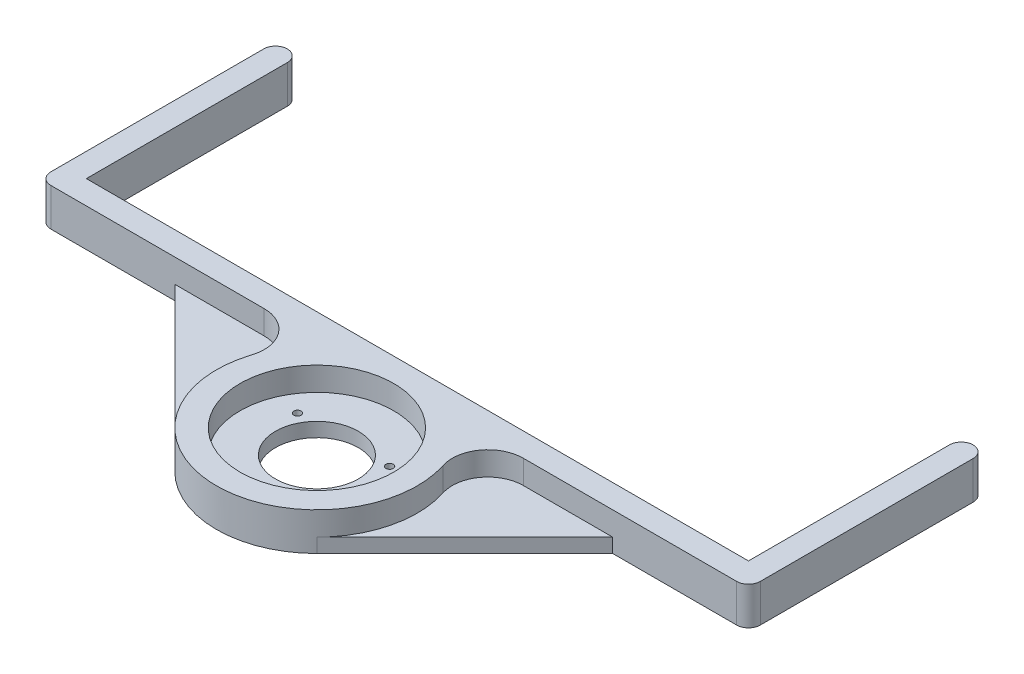
from build123d import *

# Parameters (mm, degrees)
SKETCH1_R           = 32.5
BOSS_EXTRUDE1_DEPTH = 10
FILLET1_R           = 5
FILLET2_R           = 15
BOSS_EXTRUDE2_START = 6
SKETCH2_R           = 1.55
SKETCH2_R_2         = 17.5
BOSS_EXTRUDE2_DEPTH = 6
CUT_EXTRUDE1_DEPTH  = 3


with BuildPart() as part:
    # Sketch1 → Boss-Extrude1 (new body)
    with BuildSketch(Plane(origin=(0, 0, 0), x_dir=(1, 0, 0), z_dir=(0, 1, 0))):
        with BuildLine():
            Line((0, 42.5), (140, 42.5))
            Line((140, 42.5), (140, 132.5))
            Line((140, 132.5), (150, 132.5))
            Line((150, 132.5), (150, 42.5))
            Line((150, 42.5), (150, 32.5))
            Line((150, 32.5), (27.386127875, 32.5))
            ThreePointArc((27.386127875, 32.5), (0, -42.5), (-27.386127875, 32.5))
            Line((-27.386127875, 32.5), (-150, 32.5))
            Line((-150, 32.5), (-150, 42.5))
            Line((-150, 42.5), (-150, 132.5))
            Line((-150, 132.5), (-140, 132.5))
            Line((-140, 132.5), (-140, 42.5))
            Line((-140, 42.5), (0, 42.5))
        make_face()
        with Locations(Location((0, 0, 0), (0, 0, 270))):
            Circle(SKETCH1_R, mode=Mode.SUBTRACT)
    extrude(amount=BOSS_EXTRUDE1_DEPTH)

    # Fillet1
    fillet1_edges = [part.edges().sort_by_distance(p)[0] for p in [
        (150, 5, -132.5),
        (140, 5, -132.5),
        (150, 5, -32.5),
        (-150, 5, -32.5),
        (-140, 5, -132.5),
        (-150, 5, -132.5),
    ]]
    fillet(fillet1_edges, radius=FILLET1_R - 0.0001)  # a hair under: the kernel refuses the full size

    # Fillet2
    fillet2_edges = [part.edges().sort_by_distance(p)[0] for p in [
        (27.386127875, 5, -32.5),
        (-27.386127875, 5, -32.5),
    ]]
    fillet(fillet2_edges, radius=FILLET2_R)

    # Sketch2 → Boss-Extrude2 (add)
    with BuildSketch(Plane.XZ.offset(BOSS_EXTRUDE2_START)):
        with BuildLine():
            Line((-30.0520382, 30.0520382), (-92.604076401, -32.5))
            Line((-92.604076401, -32.5), (-145, -32.5))
            ThreePointArc((-145, -32.5), (-148.535533906, -33.964466094), (-150, -37.5))
            Line((-150, -37.5), (-150, -127.5))
            ThreePointArc((-150, -127.5), (-148.535533906, -131.035533906), (-145, -132.5))
            ThreePointArc((-145, -132.5), (-141.464466094, -131.035533906), (-140, -127.5))
            Line((-140, -127.5), (-140, -42.5))
            Line((-140, -42.5), (140, -42.5))
            Line((140, -42.5), (140, -127.5))
            ThreePointArc((140, -127.5), (141.464466094, -131.035533906), (145, -132.5))
            ThreePointArc((145, -132.5), (148.535533906, -131.035533906), (150, -127.5))
            Line((150, -127.5), (150, -37.5))
            ThreePointArc((150, -37.5), (148.535533906, -33.964466094), (145, -32.5))
            Line((145, -32.5), (92.604076401, -32.5))
            Line((92.604076401, -32.5), (30.0520382, 30.0520382))
            ThreePointArc((30.0520382, 30.0520382), (0, 42.5), (-30.0520382, 30.0520382))
        make_face()
        with Locations(Location((0, 22.5, 0), (0, 0, 270))):
            Circle(SKETCH2_R, mode=Mode.SUBTRACT)
        with Locations(Location((19.485571585, -11.25, 0), (0, 0, 270))):
            Circle(SKETCH2_R, mode=Mode.SUBTRACT)
        with Locations(Location((-19.485571585, -11.25, 0), (0, 0, 270))):
            Circle(SKETCH2_R, mode=Mode.SUBTRACT)
        with Locations(Location((0, 0, 0), (0, 0, 270))):
            Circle(SKETCH2_R_2, mode=Mode.SUBTRACT)
    extrude(amount=-BOSS_EXTRUDE2_DEPTH)

    # Sketch4 → Cut-Extrude1 (cut)
    with BuildSketch(Plane.XZ.offset(6)):
        Polygon((17.519605061, -14.655153906), (21.451538109, -14.655153906), (23.417504634, -11.25), (21.451538109, -7.844846094), (17.519605061, -7.844846094), (15.553638537, -11.25), align=None)
        Polygon((3.931933048, 22.5), (1.965966524, 25.905153906), (-1.965966524, 25.905153906), (-3.931933048, 22.5), (-1.965966524, 19.094846094), (1.965966524, 19.094846094), align=None)
        Polygon((-21.451538109, -7.844846094), (-23.417504634, -11.25), (-21.451538109, -14.655153906), (-17.519605061, -14.655153906), (-15.553638537, -11.25), (-17.519605061, -7.844846094), align=None)
    extrude(amount=-CUT_EXTRUDE1_DEPTH, mode=Mode.SUBTRACT)


solid = part.part
